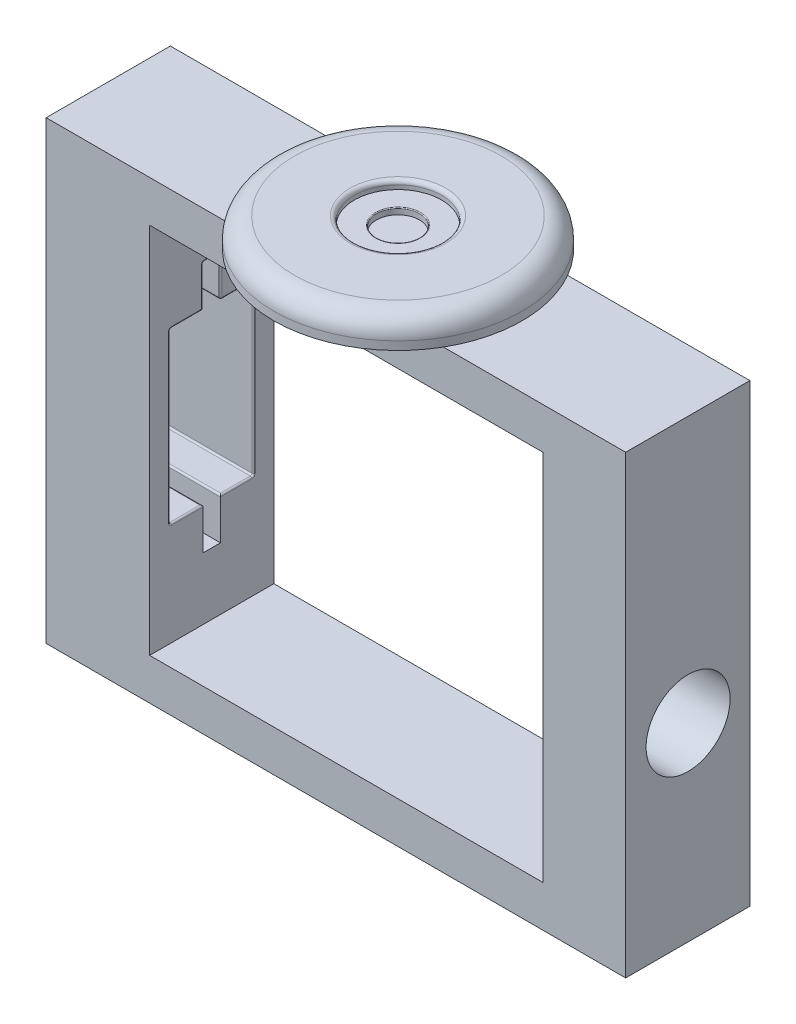
from build123d import *

# Parameters (mm, degrees)
FILLET1_R           = 1
SKETCH2_R           = 5.2
CUT_EXTRUDE1_DEPTH  = 1.5
FILLET2_R           = 0.2
FILLET3_R           = 5
CUT_EXTRUDE2_DEPTH  = 1
SKETCH14_W          = 140
SKETCH14_H          = 30
BOSS_EXTRUDE1_DEPTH = 10
SKETCH15_W          = 25
SKETCH15_H          = 30
SKETCH15_W_2        = 20
BOSS_EXTRUDE2_DEPTH = 90
SKETCH16_W          = 140
SKETCH16_H          = 30
BOSS_EXTRUDE3_DEPTH = 10
SKETCH17_W          = 20.2
SKETCH17_H          = 40.8
CUT_EXTRUDE3_DEPTH  = 25
SKETCH19_W          = 25
SKETCH19_H          = 4.2
CUT_EXTRUDE4_DEPTH  = 10
SKETCH21_W          = 25
SKETCH21_H          = 4.2
CUT_EXTRUDE6_DEPTH  = 10
FILLET4_R           = 0.4
SKETCH22_R          = 10.15
CUT_EXTRUDE7_DEPTH  = 22


with BuildPart() as part:
    # Sketch1 → Revolve1 (revolve)
    with BuildSketch(Plane(origin=(0, 0, 0), x_dir=(0, 0, -1), z_dir=(1, 0, 0))):
        Polygon((0, 0), (-30, 0), (-30, 7), (-20.102542457, 7), (-10.55, 7), (-10.55, 5), (0, 5), align=None)
    revolve(axis=Axis((0, 5, 0), (0, -1, 0)))

    # Fillet1
    fillet1_edges = [part.edges().sort_by_distance(p)[0] for p in [
        (0, 7, -10.55),
    ]]
    fillet(fillet1_edges, radius=FILLET1_R)

    # Sketch2 → Cut-Extrude1 (cut)
    with BuildSketch(Plane(origin=(0, 5, 0), x_dir=(1, 0, 0), z_dir=(0, 1, 0))):
        Circle(SKETCH2_R)
    extrude(amount=-CUT_EXTRUDE1_DEPTH, mode=Mode.SUBTRACT)

    # Fillet2
    fillet2_edges = [part.edges().sort_by_distance(p)[0] for p in [
        (-5.2, 5, 0),
    ]]
    fillet(fillet2_edges, radius=FILLET2_R)

    # Fillet3
    fillet3_edges = [part.edges().sort_by_distance(p)[0] for p in [
        (0, 7, -30),
    ]]
    fillet(fillet3_edges, radius=FILLET3_R)

    # Sketch4 → Cut-Extrude2 (cut)
    # profile 1 of 4: a face of its own
    with BuildSketch(Plane.XZ):
        Polygon((-0.644909543, 25.480704332), (0.002225874, 25.480704332), (0.002225874, 21.980704332), (-0.31187669, 21.980704332), (-0.31187669, 25.121729973), (-0.850338229, 25.121729973), align=None)
    # profile 2 of 4: a face of its own
    with BuildSketch(Plane.XZ):
        with BuildLine():
            Line((25.523815675, 2.292498481), (25.209713111, 2.292498481))
            add(Edge.make_bspline(
                [(25.209713111, 2.292498481), (25.211760264, 2.334169369), (25.215780818, 2.416009884), (25.234609107, 2.53533379), (25.261549984, 2.649388589), (25.299641438, 2.757258503), (25.346947716, 2.85989731), (25.403677743, 2.956897326), (25.470871594, 3.047888515), (25.547078328, 3.132027358), (25.629846967, 3.209214929), (25.719152906, 3.275870171), (25.812997934, 3.332187843), (25.911097333, 3.379269085), (26.014557896, 3.414608931), (26.122440754, 3.44083057), (26.23521989, 3.456606916), (26.312059912, 3.458302702), (26.351139393, 3.459165148)],
                knots=[0, 0, 0, 0, 1.10065271, 2.161652631, 3.183658789, 4.190468796, 5.17591951, 6.163126047, 7.15150782, 8.156236427, 9.156009102, 10.134482811, 11.092018607, 12.041330605, 13.001268258, 13.972401359, 14.968799086, 16, 16, 16, 16], degree=3))
            add(Edge.make_bspline(
                [(26.351139393, 3.459165148), (26.389517467, 3.458266692), (26.464929011, 3.456501257), (26.574991026, 3.441340228), (26.67976832, 3.417594636), (26.779056087, 3.38427922), (26.872062151, 3.339494792), (26.959485196, 3.285697254), (27.042366007, 3.223477422), (27.11697279, 3.150223609), (27.18548087, 3.072021224), (27.244583125, 2.988533321), (27.295196288, 2.902304035), (27.337383968, 2.812675833), (27.368440107, 2.718804805), (27.392018315, 2.622057602), (27.405345729, 2.521432791), (27.407391152, 2.453326236), (27.408431059, 2.418700405)],
                knots=[0, 0, 0, 0, 1.111607364, 2.184268762, 3.212621178, 4.221274766, 5.211760367, 6.196651075, 7.1921475, 8.207485113, 9.220403448, 10.201281604, 11.166441695, 12.114753415, 13.065576456, 14.026450734, 14.996634279, 16, 16, 16, 16], degree=3))
            add(Edge.make_bspline(
                [(27.408431059, 2.418700405), (27.406744414, 2.369950595), (27.403400723, 2.273306467), (27.37454502, 2.13110211), (27.329962923, 1.99319705), (27.275889894, 1.882217998), (27.221269326, 1.793241105), (27.17308953, 1.719325464), (27.115437178, 1.640499047), (27.048839764, 1.555967938), (26.974301958, 1.465473568), (26.89128729, 1.368978802), (26.7991616, 1.267508497), (26.734503418, 1.198202684), (26.700999168, 1.162290148)],
                knots=[0, 0, 0, 0, 1.184203166, 2.347625244, 3.513805382, 4.700623107, 5.337941753, 6.051866363, 6.845199593, 7.711357327, 8.668078039, 9.695487809, 10.805859518, 12, 12, 12, 12], degree=3))
            Line((26.700999168, 1.162290148), (25.825298046, 0.228395917))
            Line((25.825298046, 0.228395917), (27.453302854, 0.228395917))
            Line((27.453302854, 0.228395917), (27.453302854, -0.130578442))
            Line((27.453302854, -0.130578442), (25.075097726, -0.130578442))
            Line((25.075097726, -0.130578442), (26.432469521, 1.317939187))
            add(Edge.make_bspline(
                [(26.432469521, 1.317939187), (26.465517408, 1.352437493), (26.528995635, 1.41870168), (26.618778212, 1.51544464), (26.6994172, 1.605194181), (26.771434593, 1.687780729), (26.833268098, 1.764412297), (26.88814033, 1.832607), (26.932105921, 1.895361451), (26.979821317, 1.968102065), (27.026035298, 2.056914382), (27.065747654, 2.165448071), (27.089962502, 2.277175324), (27.092867338, 2.352677361), (27.094328495, 2.390655533)],
                knots=[0, 0, 0, 0, 1.329631726, 2.553950428, 3.673215718, 4.687767853, 5.603093632, 6.413772471, 7.123043292, 7.734684054, 8.834405432, 9.900288307, 10.943827018, 12, 12, 12, 12], degree=3))
            add(Edge.make_bspline(
                [(27.094328495, 2.390655533), (27.093692753, 2.414536931), (27.092439827, 2.461602582), (27.081382129, 2.530608341), (27.064671623, 2.597173154), (27.040726365, 2.661501774), (27.009119625, 2.722947426), (26.970646245, 2.781584906), (26.926256182, 2.838273871), (26.874904912, 2.891427169), (26.818493393, 2.940108375), (26.758899143, 2.98323246), (26.695849039, 3.019271571), (26.629608917, 3.048815068), (26.560363447, 3.071990449), (26.487978702, 3.088049029), (26.412654686, 3.098131512), (26.36122119, 3.099495684), (26.335013591, 3.100190789)],
                knots=[0, 0, 0, 0, 0.991446411, 1.95395049, 2.89581595, 3.838931463, 4.798493298, 5.75982156, 6.748411868, 7.785213223, 8.824556874, 9.840280684, 10.836137867, 11.835679398, 12.848801643, 13.863922112, 14.911575587, 16, 16, 16, 16], degree=3))
            add(Edge.make_bspline(
                [(26.335013591, 3.100190789), (26.307642759, 3.099475757), (26.253890962, 3.098071552), (26.174971929, 3.088248888), (26.099686152, 3.071303047), (26.027844249, 3.048126373), (25.959324663, 3.018667824), (25.894460619, 2.981976079), (25.83339773, 2.938192586), (25.776021206, 2.88855203), (25.723157227, 2.833284429), (25.676710352, 2.771674466), (25.636126337, 2.70484705), (25.600717104, 2.6329825), (25.571961414, 2.55542872), (25.549988263, 2.472461015), (25.532601417, 2.384439633), (25.526792896, 2.323654549), (25.523815675, 2.292498481)],
                knots=[0, 0, 0, 0, 1.031018746, 2.02475058, 2.990194455, 3.934040569, 4.864654155, 5.795059489, 6.735614925, 7.690564532, 8.649604399, 9.611025574, 10.590972636, 11.591080095, 12.624614302, 13.701020113, 14.821632451, 16, 16, 16, 16], degree=3))
        make_face()
    # profile 3 of 4: a face of its own
    with BuildSketch(Plane.XZ):
        with BuildLine():
            Line((0.191598009, -25.382057247), (-0.122504556, -25.382057247))
            add(Edge.make_bspline(
                [(-0.122504556, -25.382057247), (-0.113995005, -25.346824763), (-0.097359529, -25.277948138), (-0.062661956, -25.179540878), (-0.024862701, -25.086417356), (0.020526404, -25.000321283), (0.070035158, -24.91952238), (0.12675788, -24.845853255), (0.188077602, -24.77744029), (0.255902552, -24.716727052), (0.327031213, -24.661749323), (0.402465833, -24.614874266), (0.480688727, -24.574550113), (0.56224186, -24.541329881), (0.647368031, -24.516304357), (0.735297655, -24.498147552), (0.826261155, -24.486356438), (0.888008745, -24.485205674), (0.919362432, -24.484621349)],
                knots=[0, 0, 0, 0, 1.162005537, 2.271625781, 3.343758855, 4.383309926, 5.390229558, 6.379919256, 7.361854164, 8.333198761, 9.295911338, 10.242430842, 11.177959212, 12.116337295, 13.062827104, 14.020064771, 14.994644689, 16, 16, 16, 16], degree=3))
            add(Edge.make_bspline(
                [(0.919362432, -24.484621349), (0.965045174, -24.48600058), (1.055414185, -24.488728955), (1.188177232, -24.513643392), (1.316204051, -24.553068524), (1.438093299, -24.607542251), (1.551311731, -24.674729564), (1.652047918, -24.754694301), (1.738936429, -24.845893603), (1.811830806, -24.946626167), (1.868905805, -25.054281676), (1.910992179, -25.165081833), (1.93661386, -25.278763805), (1.939934417, -25.355521084), (1.941598009, -25.393976317)],
                knots=[0, 0, 0, 0, 1.083050992, 2.142477498, 3.193116406, 4.255571735, 5.30263384, 6.308962982, 7.297363603, 8.282367274, 9.249857812, 10.179914175, 11.08814088, 12, 12, 12, 12], degree=3))
            add(Edge.make_bspline(
                [(1.941598009, -25.393976317), (1.940434418, -25.430983112), (1.93815745, -25.503399667), (1.918823745, -25.609121164), (1.886287482, -25.708762764), (1.841217719, -25.802743926), (1.782876169, -25.890468766), (1.712203472, -25.972134657), (1.628700811, -26.048103815), (1.565421872, -26.091623288), (1.532844002, -26.114028401)],
                knots=[0, 0, 0, 0, 1.024540389, 2.004866551, 2.965041327, 3.920577974, 4.882998113, 5.874504559, 6.905732034, 8, 8, 8, 8], degree=3))
            add(Edge.make_bspline(
                [(1.532844002, -26.114028401), (1.570075757, -26.132006572), (1.643842631, -26.16762653), (1.744393161, -26.237482287), (1.835671036, -26.318138635), (1.886574755, -26.381081288), (1.912150893, -26.412706285)],
                knots=[0, 0, 0, 0, 1.015518401, 2.012035669, 3.001164323, 4, 4, 4, 4], degree=3))
            add(Edge.make_bspline(
                [(1.912150893, -26.412706285), (1.928992236, -26.435764037), (1.962399132, -26.481501953), (2.003634665, -26.555038379), (2.04104378, -26.629389869), (2.070193999, -26.706549275), (2.092767866, -26.785622288), (2.108903898, -26.866744684), (2.118928039, -26.949982707), (2.120363591, -27.006295187), (2.121085188, -27.034601317)],
                knots=[0, 0, 0, 0, 1.025084078, 2.033381695, 3.024893161, 4.013698104, 4.991890475, 5.976764909, 6.982997093, 8, 8, 8, 8], degree=3))
            add(Edge.make_bspline(
                [(2.121085188, -27.034601317), (2.119290675, -27.083611039), (2.115710093, -27.18139984), (2.083706018, -27.325874562), (2.034092778, -27.467100064), (1.963635842, -27.602174904), (1.877768333, -27.728555285), (1.775611009, -27.841631594), (1.6583246, -27.938830198), (1.527518951, -28.020040426), (1.385801823, -28.084958348), (1.234226231, -28.130015791), (1.074976177, -28.159361791), (0.965768879, -28.16250866), (0.910247848, -28.164108529)],
                knots=[0, 0, 0, 0, 0.955779014, 1.907060117, 2.875433937, 3.871313158, 4.872415639, 5.851225146, 6.836215519, 7.83643374, 8.849228613, 9.86973379, 10.916971861, 12, 12, 12, 12], degree=3))
            add(Edge.make_bspline(
                [(0.910247848, -28.164108529), (0.872828548, -28.163240316), (0.799199843, -28.161531961), (0.690956345, -28.14985336), (0.587634645, -28.128523355), (0.489095047, -28.09982005), (0.395250011, -28.063428308), (0.306385906, -28.01810961), (0.221956012, -27.964798108), (0.142757061, -27.90286452), (0.068798493, -27.83358318), (0.002045769, -27.75572417), (-0.058614024, -27.670726766), (-0.111556662, -27.57760371), (-0.159193615, -27.477558453), (-0.198374572, -27.369309954), (-0.23286014, -27.253825932), (-0.248893605, -27.173348192), (-0.25711994, -27.132057247)],
                knots=[0, 0, 0, 0, 1.048658725, 2.063410685, 3.046034179, 4.001477787, 4.936774919, 5.862367409, 6.792675028, 7.730719943, 8.675894397, 9.627829632, 10.600096036, 11.597688215, 12.626045268, 13.701542398, 14.82072376, 16, 16, 16, 16], degree=3))
            Line((-0.25711994, -27.132057247), (0.056982624, -27.132057247))
            add(Edge.make_bspline(
                [(0.056982624, -27.132057247), (0.065165915, -27.15900626), (0.081083128, -27.211424432), (0.108177426, -27.286864737), (0.139045698, -27.356022791), (0.172160257, -27.419405913), (0.206938703, -27.477638315), (0.245853628, -27.529180184), (0.286022773, -27.576295386), (0.316302126, -27.602839998), (0.331121246, -27.615831285)],
                knots=[0, 0, 0, 0, 1.198163088, 2.33053128, 3.407730985, 4.417276592, 5.372219308, 6.28897303, 7.162600585, 8, 8, 8, 8], degree=3))
            add(Edge.make_bspline(
                [(0.331121246, -27.615831285), (0.350717822, -27.630939619), (0.389850485, -27.661109651), (0.453618716, -27.69961128), (0.520683602, -27.732972305), (0.592498277, -27.758456001), (0.667513047, -27.780033661), (0.746940412, -27.79415418), (0.830079629, -27.803842352), (0.886847393, -27.804697283), (0.915856823, -27.80513417)],
                knots=[0, 0, 0, 0, 0.946170439, 1.889420265, 2.845303464, 3.807233317, 4.801018734, 5.828864929, 6.890507805, 8, 8, 8, 8], degree=3))
            add(Edge.make_bspline(
                [(0.915856823, -27.80513417), (0.948610325, -27.804518265), (1.012656972, -27.803313915), (1.106111832, -27.792238208), (1.195019279, -27.776107795), (1.278392205, -27.751194812), (1.357322712, -27.720413961), (1.430704362, -27.681765555), (1.499500468, -27.636420833), (1.562829874, -27.584881675), (1.619775381, -27.52846018), (1.669914894, -27.469447109), (1.712539556, -27.408091279), (1.746923134, -27.344053158), (1.774073684, -27.277597929), (1.792556885, -27.2085391), (1.8054084, -27.137441834), (1.806455012, -27.089112865), (1.806982624, -27.064749555)],
                knots=[0, 0, 0, 0, 1.217147791, 2.380027433, 3.494444702, 4.572153297, 5.609568379, 6.639424714, 7.649109417, 8.668170816, 9.669597737, 10.625200337, 11.543417969, 12.441394052, 13.322311151, 14.205496177, 15.095365482, 16, 16, 16, 16], degree=3))
            add(Edge.make_bspline(
                [(1.806982624, -27.064749555), (1.805452322, -27.032138216), (1.802399334, -26.967077807), (1.779090755, -26.871360233), (1.74075189, -26.779136821), (1.687079379, -26.691981031), (1.62174365, -26.611205129), (1.545378744, -26.539133647), (1.457350515, -26.479663556), (1.376330646, -26.438574899), (1.30456549, -26.410537824), (1.243150105, -26.39186286), (1.174393502, -26.376049204), (1.099127153, -26.361336932), (1.016783936, -26.348815584), (0.927453498, -26.338373768), (0.831117737, -26.330018727), (0.764426571, -26.326287632), (0.730059547, -26.324364939)],
                knots=[0, 0, 0, 0, 1.07054697, 2.135767047, 3.216561865, 4.33974944, 5.486079747, 6.621378074, 7.775625952, 8.963672916, 9.598146892, 10.304877434, 11.070270905, 11.915000392, 12.823868403, 13.805723172, 14.86925407, 16, 16, 16, 16], degree=3))
            Line((0.730059547, -26.324364939), (0.730059547, -25.96539058))
            add(Edge.make_bspline(
                [(0.730059547, -25.96539058), (0.773360713, -25.964655776), (0.858177059, -25.963216476), (0.982071364, -25.945808466), (1.100544676, -25.921727838), (1.210971418, -25.884842646), (1.311620132, -25.842002349), (1.398939734, -25.792150139), (1.471706881, -25.73673539), (1.529567952, -25.674902781), (1.573097181, -25.608587733), (1.604923979, -25.539471076), (1.623724305, -25.466947015), (1.626233972, -25.417452347), (1.627495444, -25.392574074)],
                knots=[0, 0, 0, 0, 1.321986639, 2.589447074, 3.816329219, 5.01088745, 6.139805852, 7.153945165, 8.075214402, 8.924034688, 9.728124013, 10.488707548, 11.240355623, 12, 12, 12, 12], degree=3))
            add(Edge.make_bspline(
                [(1.627495444, -25.392574074), (1.627081034, -25.374296329), (1.626256583, -25.337933622), (1.615859305, -25.284808553), (1.600235264, -25.233307607), (1.578755535, -25.183649797), (1.550005336, -25.136179523), (1.515599349, -25.090492074), (1.474631249, -25.046848295), (1.427685802, -25.006167975), (1.377273997, -24.967398738), (1.322024222, -24.934485101), (1.263602347, -24.906340039), (1.201943692, -24.883130537), (1.136848162, -24.865671249), (1.068621604, -24.853135407), (0.997133921, -24.845297753), (0.948362189, -24.844169337), (0.923569162, -24.843595708)],
                knots=[0, 0, 0, 0, 0.884392785, 1.759457502, 2.611959086, 3.489218968, 4.37281399, 5.2945488, 6.255912374, 7.266815255, 8.301784654, 9.332968512, 10.37626691, 11.440494194, 12.520033166, 13.637162961, 14.798855837, 16, 16, 16, 16], degree=3))
            add(Edge.make_bspline(
                [(0.923569162, -24.843595708), (0.883717494, -24.84498707), (0.805877918, -24.847704724), (0.693663001, -24.871507737), (0.589343667, -24.909485821), (0.509605001, -24.95481884), (0.450722426, -24.999569274), (0.408645488, -25.038651661), (0.367324978, -25.082084484), (0.329479301, -25.13254286), (0.291205324, -25.18660965), (0.256360763, -25.247033331), (0.22250107, -25.312237726), (0.202098521, -25.35833336), (0.191598009, -25.382057247)],
                knots=[0, 0, 0, 0, 1.472543308, 2.876219568, 4.221790263, 5.565193594, 6.249813518, 6.953379497, 7.687249741, 8.463570142, 9.283606569, 10.136032583, 11.040678096, 12, 12, 12, 12], degree=3))
        make_face()
    # profile 4 of 4: a face of its own
    with BuildSketch(Plane.XZ):
        Polygon((-24.810460542, 5.722524802), (-24.746658459, 5.722524802), (-24.746658459, 3.299447879), (-24.342812305, 3.299447879), (-24.342812305, 2.94047352), (-24.746658459, 2.94047352), (-24.746658459, 2.132781212), (-25.060761023, 2.132781212), (-25.060761023, 2.94047352), (-26.721017433, 2.94047352), align=None)
        Polygon((-25.060761023, 3.299447879), (-25.060761023, 4.818077687), (-26.103329132, 3.299447879), align=None, mode=Mode.SUBTRACT)
    extrude(amount=-CUT_EXTRUDE2_DEPTH, mode=Mode.SUBTRACT)

    # Sketch14 → Boss-Extrude1 (add)
    with BuildSketch(Plane.XZ):
        Rectangle(SKETCH14_W, SKETCH14_H)
    extrude(amount=BOSS_EXTRUDE1_DEPTH)

    # Sketch15 → Boss-Extrude2 (add)
    with BuildSketch(Plane.XZ.offset(10)):
        with Locations((-57.5, 0)):
            Rectangle(SKETCH15_W, SKETCH15_H)
        with Locations((60, 0)):
            Rectangle(SKETCH15_W_2, SKETCH15_H)
    extrude(amount=BOSS_EXTRUDE2_DEPTH)

    # Sketch16 → Boss-Extrude3 (add)
    with BuildSketch(Plane.XZ.offset(100)):
        Rectangle(SKETCH16_W, SKETCH16_H)
    extrude(amount=BOSS_EXTRUDE3_DEPTH)

    # Sketch17 → Cut-Extrude3 (cut)
    with BuildSketch(Plane(origin=(-45, 0, 0), x_dir=(0, 0, -1), z_dir=(1, 0, 0))):
        with Locations((0, -54.6)):
            Rectangle(SKETCH17_W, SKETCH17_H)
    extrude(amount=-CUT_EXTRUDE3_DEPTH, mode=Mode.SUBTRACT)

    # Sketch19 → Cut-Extrude4 (cut)
    with BuildSketch(Plane.XZ.offset(34.2)):
        with Locations((-57.5, 0)):
            Rectangle(SKETCH19_W, SKETCH19_H)
    extrude(amount=-CUT_EXTRUDE4_DEPTH, mode=Mode.SUBTRACT)

    # Sketch21 → Cut-Extrude6 (cut)
    with BuildSketch(Plane(origin=(0, -75, 0), x_dir=(1, 0, 0), z_dir=(0, 1, 0))):
        with Locations((-57.5, 0)):
            Rectangle(SKETCH21_W, SKETCH21_H)
    extrude(amount=-CUT_EXTRUDE6_DEPTH, mode=Mode.SUBTRACT)

    # Fillet4
    fillet4_edges = [part.edges().sort_by_distance(p)[0] for p in [
        (-70, -75, -6.1),
        (-45, -75, -6.1),
        (-70, -34.2, -6.1),
        (-45, -34.2, -6.1),
        (-70, -24.2, 0),
        (-45, -24.2, 0),
        (-70, -34.2, 6.1),
        (-45, -34.2, 6.1),
        (-70, -75, 6.1),
        (-45, -75, 6.1),
        (-57.5, -75, -10.1),
        (-70, -54.6, -10.1),
        (-57.5, -34.2, -10.1),
        (-45, -54.6, -10.1),
        (-45, -29.2, 2.1),
        (-57.5, -24.2, 2.1),
        (-70, -29.2, 2.1),
        (-57.5, -34.2, 2.1),
        (-70, -29.2, -2.1),
        (-57.5, -24.2, -2.1),
        (-45, -29.2, -2.1),
        (-57.5, -34.2, -2.1),
        (-57.5, -34.2, 10.1),
        (-70, -54.6, 10.1),
        (-57.5, -75, 10.1),
        (-45, -54.6, 10.1),
        (-57.5, -75, 2.1),
        (-57.5, -75, -2.1),
    ]]
    fillet(fillet4_edges, radius=FILLET4_R)

    # Sketch22 → Cut-Extrude7 (cut)
    with BuildSketch(Plane(origin=(70, 0, 0), x_dir=(0, 0, -1), z_dir=(1, 0, 0))):
        with Locations((0.08865233, -64.192614688)):
            Circle(SKETCH22_R)
    extrude(amount=-CUT_EXTRUDE7_DEPTH, mode=Mode.SUBTRACT)


solid = part.part
